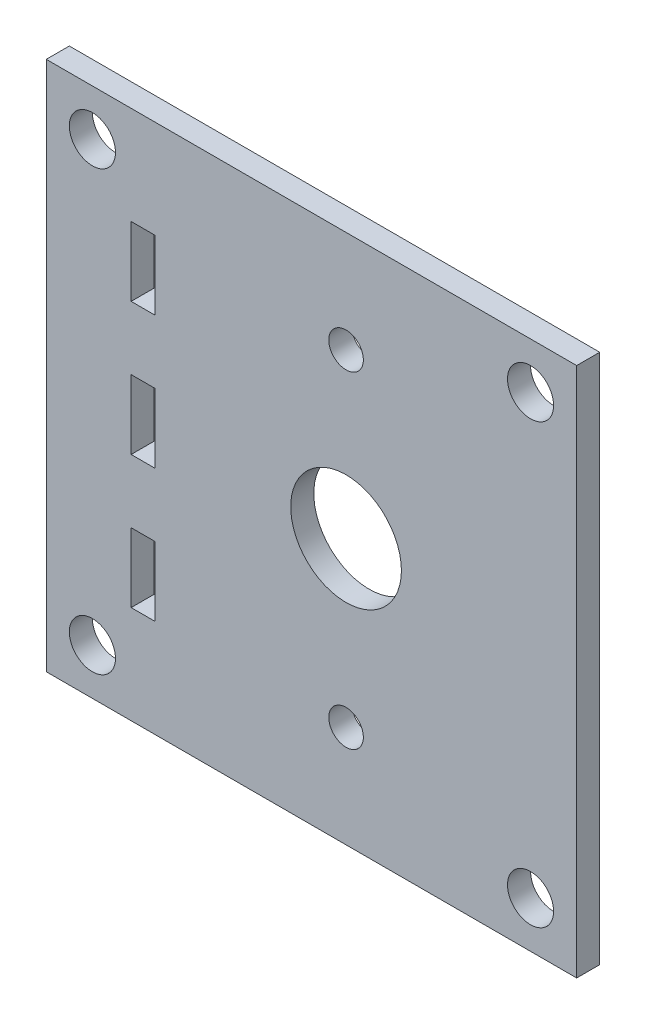
from build123d import *

# Parameters (mm, degrees)
SKETCH1_W           = 146.05
SKETCH1_H           = 146.05
SKETCH1_R           = 6.35
SKETCH1_R_2         = 15.24
SKETCH1_R_3         = 4.7625
SKETCH1_W_2         = 6.604
SKETCH1_H_2         = 19.05
BOSS_EXTRUDE1_DEPTH = 3.175


with BuildPart() as part:
    # Sketch1 → Boss-Extrude1 (new, symmetric)
    with BuildSketch(Plane.XY):
        with Locations((-9.525, 0)):
            Rectangle(SKETCH1_W, SKETCH1_H)
        with Locations((50.8, 60.325)):
            Circle(SKETCH1_R, mode=Mode.SUBTRACT)
        with Locations((50.8, -60.325)):
            Circle(SKETCH1_R, mode=Mode.SUBTRACT)
        Circle(SKETCH1_R_2, mode=Mode.SUBTRACT)
        with Locations((0, 45)):
            Circle(SKETCH1_R_3, mode=Mode.SUBTRACT)
        with Locations((0, -45)):
            Circle(SKETCH1_R_3, mode=Mode.SUBTRACT)
        with Locations((-69.85, 60.325)):
            Circle(SKETCH1_R, mode=Mode.SUBTRACT)
        with Locations((-69.85, -60.325)):
            Circle(SKETCH1_R, mode=Mode.SUBTRACT)
        with Locations((-55.88, 0)):
            Rectangle(SKETCH1_W_2, SKETCH1_H_2, mode=Mode.SUBTRACT)
        with Locations((-55.88, 36.5125)):
            Rectangle(SKETCH1_W_2, SKETCH1_H_2, mode=Mode.SUBTRACT)
        with Locations((-55.88, -36.5125)):
            Rectangle(SKETCH1_W_2, SKETCH1_H_2, mode=Mode.SUBTRACT)
    extrude(amount=BOSS_EXTRUDE1_DEPTH, both=True)


solid = part.part
